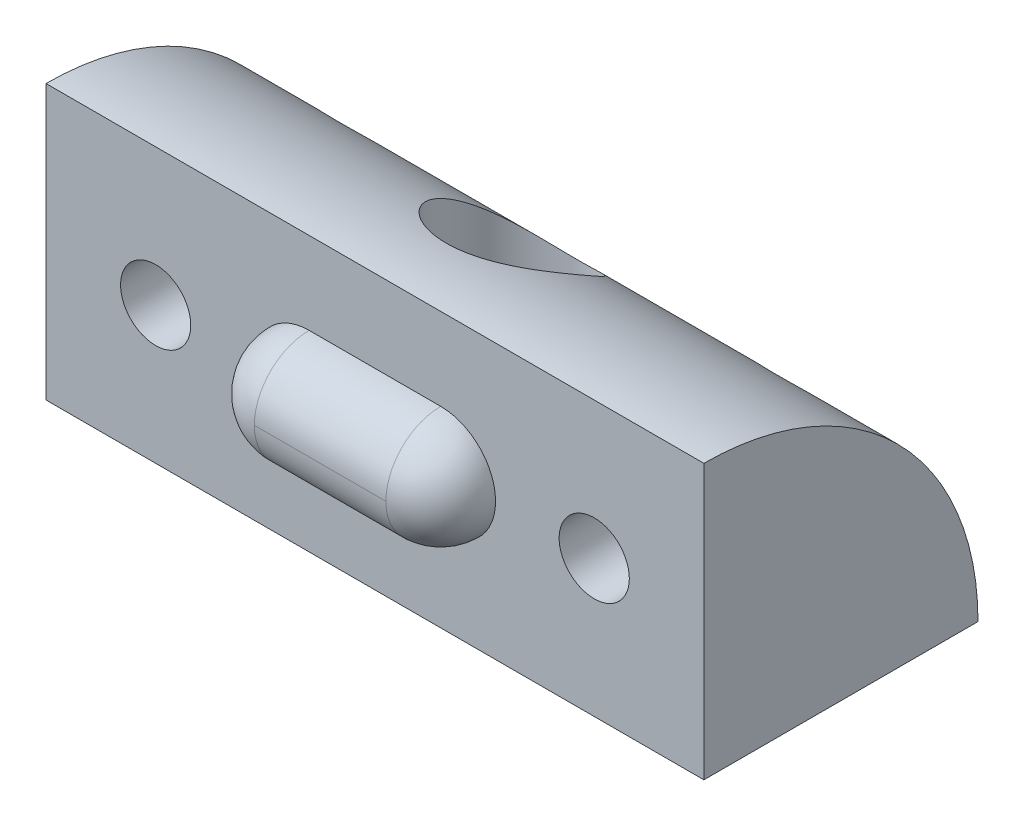
from build123d import *

# Parameters (mm, degrees)
SALIENTE_EXTRUIR1_DEPTH    = 70
CORTAR_EXTRUIR1_REACH      = 74.198
CORTAR_EXTRUIR1_END_RADIUS = 12.5
CROQUIS2_R                 = 1.6
CORTAR_EXTRUIR2_REACH      = 73.614
CORTAR_EXTRUIR2_END_RADIUS = 12.5
CROQUIS3_R                 = 3
CORTAR_EXTRUIR3_REACH      = 74.198
CORTAR_EXTRUIR3_END_RADIUS = 12.5
CROQUIS4_R                 = 3
CROQUIS6_W                 = 16.861787602
CROQUIS6_H                 = 17.380881654
CORTAR_EXTRUIR5_DEPTH      = 40
SALIENTE_EXTRUIR2_DEPTH    = 2.5
REDONDEO1_R                = 2.5


with BuildPart() as part:
    # Croquis1 → Saliente-Extruir1 (new body)
    with BuildSketch(Plane(origin=(0, 0, 0), x_dir=(0, 0, -1), z_dir=(1, 0, 0))):
        with BuildLine():
            Line((0, 0), (0, 12.5))
            ThreePointArc((0, 12.5), (8.838834765, 8.838834765), (12.5, 0))
            Line((12.5, 0), (0, 0))
        make_face()
    extrude(amount=SALIENTE_EXTRUIR1_DEPTH)

    # Cortar-Extruir1: up to this cylinder (the profile starts inside it)
    cortar_extruir1_end = Plane(origin=(35, 0, 0), z_dir=(-1, 0, 0)) * Cylinder(CORTAR_EXTRUIR1_END_RADIUS, 234.396, mode=Mode.PRIVATE)
    # Croquis2 → Cortar-Extruir1 (cut, up to the surface)
    with BuildSketch(Plane.XY, mode=Mode.PRIVATE) as cortar_extruir1_sk1:
        with Locations((5, 6.25)):
            Circle(CROQUIS2_R)
    cortar_extruir1_tool1 = extrude(cortar_extruir1_sk1.sketch, amount=-CORTAR_EXTRUIR1_REACH, mode=Mode.PRIVATE) & cortar_extruir1_end
    add(cortar_extruir1_tool1.solids().sort_by_distance((5, 6.25, 0))[0], mode=Mode.SUBTRACT)
    # Croquis2 → Cortar-Extruir1 (cut, up to the surface)
    with BuildSketch(Plane.XY, mode=Mode.PRIVATE) as cortar_extruir1_sk2:
        with Locations((25, 6.25)):
            Circle(CROQUIS2_R)
    cortar_extruir1_tool2 = extrude(cortar_extruir1_sk2.sketch, amount=-CORTAR_EXTRUIR1_REACH, mode=Mode.PRIVATE) & cortar_extruir1_end
    add(cortar_extruir1_tool2.solids().sort_by_distance((25, 6.25, 0))[0], mode=Mode.SUBTRACT)
    # Croquis2 → Cortar-Extruir1 (cut, up to the surface)
    with BuildSketch(Plane.XY, mode=Mode.PRIVATE) as cortar_extruir1_sk3:
        with Locations((45, 6.25)):
            Circle(CROQUIS2_R)
    cortar_extruir1_tool3 = extrude(cortar_extruir1_sk3.sketch, amount=-CORTAR_EXTRUIR1_REACH, mode=Mode.PRIVATE) & cortar_extruir1_end
    add(cortar_extruir1_tool3.solids().sort_by_distance((45, 6.25, 0))[0], mode=Mode.SUBTRACT)
    # Croquis2 → Cortar-Extruir1 (cut, up to the surface)
    with BuildSketch(Plane.XY, mode=Mode.PRIVATE) as cortar_extruir1_sk4:
        with Locations((65, 6.25)):
            Circle(CROQUIS2_R)
    cortar_extruir1_tool4 = extrude(cortar_extruir1_sk4.sketch, amount=-CORTAR_EXTRUIR1_REACH, mode=Mode.PRIVATE) & cortar_extruir1_end
    add(cortar_extruir1_tool4.solids().sort_by_distance((65, 6.25, 0))[0], mode=Mode.SUBTRACT)

    # Cortar-Extruir2: up to this cylinder (the profile starts inside it)
    cortar_extruir2_end = Plane(origin=(35, 0, 0), z_dir=(-1, 0, 0)) * Cylinder(CORTAR_EXTRUIR2_END_RADIUS, 233.228, mode=Mode.PRIVATE)
    # Croquis3 → Cortar-Extruir2 (cut, up to the surface)
    with BuildSketch(Plane.XY.offset(-4), mode=Mode.PRIVATE) as cortar_extruir2_sk1:
        with Locations((5, 6.25)):
            Circle(CROQUIS3_R)
    cortar_extruir2_tool1 = extrude(cortar_extruir2_sk1.sketch, amount=-CORTAR_EXTRUIR2_REACH, mode=Mode.PRIVATE) & cortar_extruir2_end
    add(cortar_extruir2_tool1.solids().sort_by_distance((5, 6.25, -4))[0], mode=Mode.SUBTRACT)
    # Croquis3 → Cortar-Extruir2 (cut, up to the surface)
    with BuildSketch(Plane.XY.offset(-4), mode=Mode.PRIVATE) as cortar_extruir2_sk2:
        with Locations((25, 6.25)):
            Circle(CROQUIS3_R)
    cortar_extruir2_tool2 = extrude(cortar_extruir2_sk2.sketch, amount=-CORTAR_EXTRUIR2_REACH, mode=Mode.PRIVATE) & cortar_extruir2_end
    add(cortar_extruir2_tool2.solids().sort_by_distance((25, 6.25, -4))[0], mode=Mode.SUBTRACT)
    # Croquis3 → Cortar-Extruir2 (cut, up to the surface)
    with BuildSketch(Plane.XY.offset(-4), mode=Mode.PRIVATE) as cortar_extruir2_sk3:
        with Locations((45, 6.25)):
            Circle(CROQUIS3_R)
    cortar_extruir2_tool3 = extrude(cortar_extruir2_sk3.sketch, amount=-CORTAR_EXTRUIR2_REACH, mode=Mode.PRIVATE) & cortar_extruir2_end
    add(cortar_extruir2_tool3.solids().sort_by_distance((45, 6.25, -4))[0], mode=Mode.SUBTRACT)
    # Croquis3 → Cortar-Extruir2 (cut, up to the surface)
    with BuildSketch(Plane.XY.offset(-4), mode=Mode.PRIVATE) as cortar_extruir2_sk4:
        with Locations((65, 6.25)):
            Circle(CROQUIS3_R)
    cortar_extruir2_tool4 = extrude(cortar_extruir2_sk4.sketch, amount=-CORTAR_EXTRUIR2_REACH, mode=Mode.PRIVATE) & cortar_extruir2_end
    add(cortar_extruir2_tool4.solids().sort_by_distance((65, 6.25, -4))[0], mode=Mode.SUBTRACT)

    # Cortar-Extruir3: up to this cylinder (the profile starts inside it)
    cortar_extruir3_end = Plane(origin=(35, 0, 0), z_dir=(-1, 0, 0)) * Cylinder(CORTAR_EXTRUIR3_END_RADIUS, 214.396, mode=Mode.PRIVATE)
    # Croquis4 → Cortar-Extruir3 (cut, up to the surface)
    with BuildSketch(Plane.XZ, mode=Mode.PRIVATE) as cortar_extruir3_sk1:
        with Locations(Location((55, -6.25, 0), (0, 0, 270))):
            Circle(CROQUIS4_R)
    cortar_extruir3_tool1 = extrude(cortar_extruir3_sk1.sketch, amount=-CORTAR_EXTRUIR3_REACH, mode=Mode.PRIVATE) & cortar_extruir3_end
    add(cortar_extruir3_tool1.solids().sort_by_distance((55, 0, -6.25))[0], mode=Mode.SUBTRACT)
    # Croquis4 → Cortar-Extruir3 (cut, up to the surface)
    with BuildSketch(Plane.XZ, mode=Mode.PRIVATE) as cortar_extruir3_sk2:
        with Locations(Location((35, -6.25, 0), (0, 0, 270))):
            Circle(CROQUIS4_R)
    cortar_extruir3_tool2 = extrude(cortar_extruir3_sk2.sketch, amount=-CORTAR_EXTRUIR3_REACH, mode=Mode.PRIVATE) & cortar_extruir3_end
    add(cortar_extruir3_tool2.solids().sort_by_distance((35, 0, -6.25))[0], mode=Mode.SUBTRACT)
    # Croquis4 → Cortar-Extruir3 (cut, up to the surface)
    with BuildSketch(Plane.XZ, mode=Mode.PRIVATE) as cortar_extruir3_sk3:
        with Locations(Location((15, -6.25, 0), (0, 0, 270))):
            Circle(CROQUIS4_R)
    cortar_extruir3_tool3 = extrude(cortar_extruir3_sk3.sketch, amount=-CORTAR_EXTRUIR3_REACH, mode=Mode.PRIVATE) & cortar_extruir3_end
    add(cortar_extruir3_tool3.solids().sort_by_distance((15, 0, -6.25))[0], mode=Mode.SUBTRACT)

    # Croquis6 → Cortar-Extruir5 (cut)
    with BuildSketch(Plane.ZY):
        with Locations((-8.430893801, 8.690440827)):
            Rectangle(CROQUIS6_W, CROQUIS6_H)
    extrude(amount=-CORTAR_EXTRUIR5_DEPTH, mode=Mode.SUBTRACT)

    # Croquis7 → Saliente-Extruir2 (add)
    with BuildSketch(Plane.XY):
        with BuildLine():
            Line((58, 8.75), (52, 8.75))
            ThreePointArc((52, 8.75), (49.5, 6.25), (52, 3.75))
            Line((52, 3.75), (58, 3.75))
            ThreePointArc((58, 3.75), (60.5, 6.25), (58, 8.75))
        make_face()
    extrude(amount=SALIENTE_EXTRUIR2_DEPTH)

    # Redondeo1
    redondeo1_edges = [part.edges().sort_by_distance(p)[0] for p in [
        (55, 3.75, 2.5),
        (49.5, 6.25, 2.5),
        (55, 8.75, 2.5),
        (60.5, 6.25, 2.5),
    ]]
    fillet(redondeo1_edges, radius=REDONDEO1_R - 0.0001)  # a hair under: the kernel refuses the full size


solid = part.part
